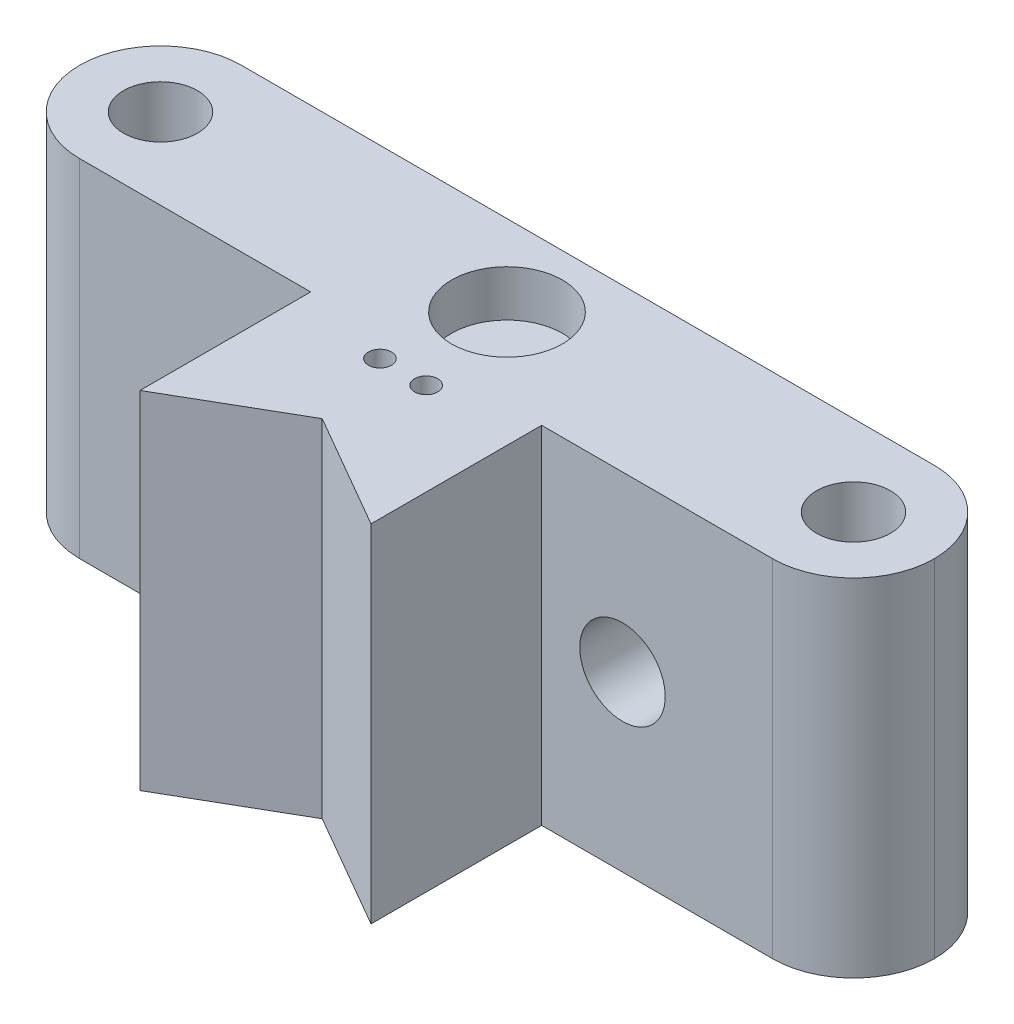
from build123d import *

# Parameters (mm, degrees)
SKIZZE1_W                       = 37
SKIZZE1_H                       = 7
SKIZZE1_R                       = 2.4
SKIZZE1_R_2                     = 1.6
SKIZZE1_R_3                     = 0.5
AUFSATZ_LINEAR_AUSTRAGEN1_DEPTH = 7.5
VERRUNDUNG1_R                   = 3.5
SKIZZE2_R                       = 1.85
SCHNITT_LINEAR_AUSTRAGEN1_DEPTH = 25.606475048
SKIZZE3_R                       = 2.4
SCHNITT_LINEAR_AUSTRAGEN2_DEPTH = 2


with BuildPart() as part:
    # Skizze1 → Aufsatz-Linear austragen1 (new, symmetric)
    # profile 1 of 3: a face of its own
    with BuildSketch(Plane(origin=(0, 0, 0), x_dir=(1, 0, 0), z_dir=(0, 1, 0))):
        Rectangle(SKIZZE1_W, SKIZZE1_H)
        Circle(SKIZZE1_R, mode=Mode.SUBTRACT)
        with Locations(Location((15, 0, 0), (0, 0, 270))):
            Circle(SKIZZE1_R_2, mode=Mode.SUBTRACT)
        with Locations(Location((-15, 0, 0), (0, 0, 270))):
            Circle(SKIZZE1_R_2, mode=Mode.SUBTRACT)
    # profile 2 of 3: a face of its own
    with BuildSketch(Plane(origin=(0, 0, 0), x_dir=(1, 0, 0), z_dir=(0, 1, 0))):
        Circle(SKIZZE1_R)
    # profile 3 of 3: a face of its own
    with BuildSketch(Plane(origin=(0, 0, 0), x_dir=(1, 0, 0), z_dir=(0, 1, 0))):
        Polygon((5, -3.5), (-5, -3.5), (-5, -10.886751346), (0, -8), (5, -10.886751346), align=None)
        with Locations(Location((-1, -4.5, 0), (0, 0, 270))):
            Circle(SKIZZE1_R_3, mode=Mode.SUBTRACT)
        with Locations(Location((1, -4.5, 0), (0, 0, 270))):
            Circle(SKIZZE1_R_3, mode=Mode.SUBTRACT)
    extrude(amount=AUFSATZ_LINEAR_AUSTRAGEN1_DEPTH, both=True)

    # Verrundung1
    verrundung1_edges = [part.edges().sort_by_distance(p)[0] for p in [
        (-18.5, 0, 3.5),
        (-18.5, 0, -3.5),
        (18.5, 0, -3.5),
        (18.5, 0, 3.5),
    ]]
    fillet(verrundung1_edges, radius=VERRUNDUNG1_R - 0.0001)  # a hair under: the kernel refuses the full size

    # Skizze2 → Schnitt-Linear austragen1 (cut, through all)
    with BuildSketch(Plane(origin=(0, 0, -3.5), x_dir=(-1, 0, 0), z_dir=(0, 0, -1))):
        with Locations((-8.5, 0)):
            Circle(SKIZZE2_R)
        with Locations((8.5, 0)):
            Circle(SKIZZE2_R)
    extrude(amount=-SCHNITT_LINEAR_AUSTRAGEN1_DEPTH, mode=Mode.SUBTRACT)

    # Skizze3 → Schnitt-Linear austragen2 (cut)
    with BuildSketch(Plane(origin=(0, 7.5, 0), x_dir=(1, 0, 0), z_dir=(0, 1, 0))):
        with Locations(Location((0, 0, 0), (0, 0, 270))):
            Circle(SKIZZE3_R)
    extrude(amount=-SCHNITT_LINEAR_AUSTRAGEN2_DEPTH, mode=Mode.SUBTRACT)


solid = part.part
